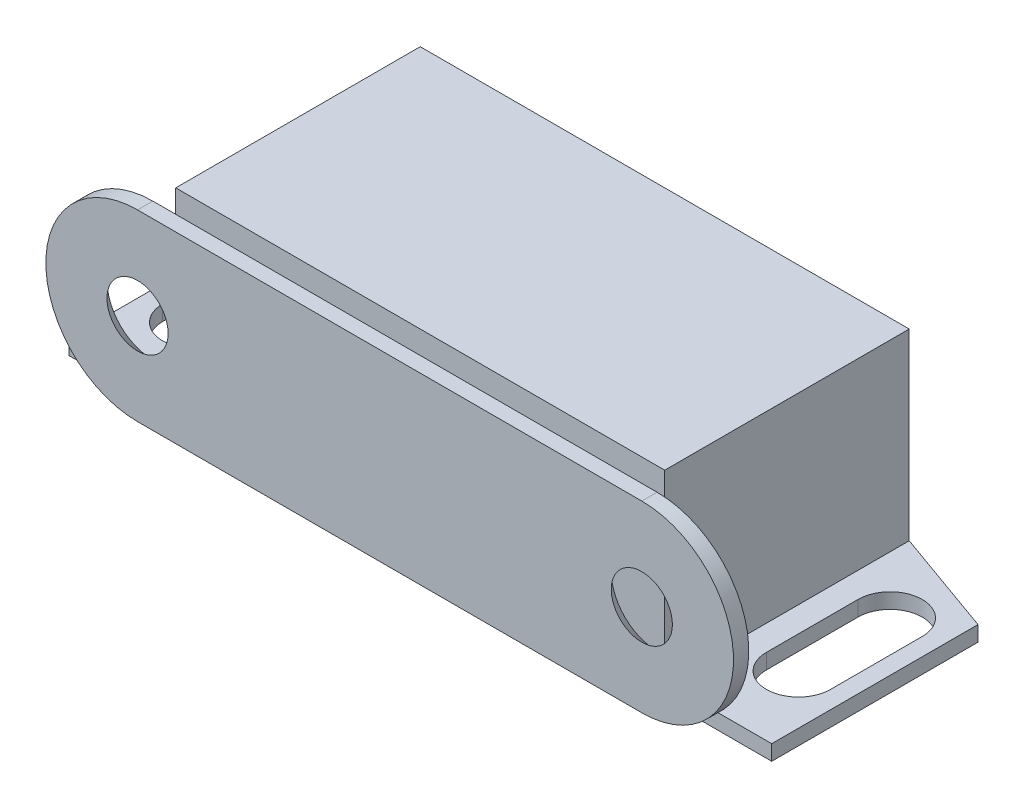
from build123d import *

# Parameters (mm, degrees)
SKETCH_1_W          = 15
SKETCH_1_H          = 12
EXTRUDE_1_DEPTH     = 16
CUT_EXTRUDE_1_DEPTH = 16
CUT_EXTRUDE_2_DEPTH = 16
SKETCH_4_W          = 22
SKETCH_4_H          = 1
EXTRUDE_2_DEPTH     = 1
SKETCH_5_R          = 2
EXTRUDE_3_DEPTH     = 1
CHAMFER_1_SIZE      = 1


with BuildPart() as part:
    # 草图1 → 凸台-拉伸1 (new body)
    with BuildSketch(Plane.XY):
        with Locations((15.5, 6)):
            Rectangle(SKETCH_1_W, SKETCH_1_H)
        with Locations((30.5, 6)):
            Rectangle(SKETCH_1_W, SKETCH_1_H)
        Polygon((0, 1), (0, 0), (8, 0), (8, 12), (23, 12), (23, 13), (7, 13), (7, 1), align=None)
        Polygon((23, 13), (23, 12), (38, 12), (38, 0), (46, 0), (46, 1), (39, 1), (39, 13), align=None)
    extrude(amount=-EXTRUDE_1_DEPTH)

    # 草图2 → 切除-拉伸1 (cut)
    with BuildSketch(Plane(origin=(0, 1, 0), x_dir=(1, 0, 0), z_dir=(0, 1, 0))):
        with BuildLine():
            Line((40.65, 5), (40.65, 11))
            ThreePointArc((40.65, 11), (42.75, 13.1), (44.85, 11))
            Line((44.85, 11), (44.85, 5))
            ThreePointArc((44.85, 5), (42.75, 2.9), (40.65, 5))
        make_face()
        with BuildLine():
            Line((5.35, 5), (5.35, 11))
            ThreePointArc((5.35, 11), (3.25, 13.1), (1.15, 11))
            Line((1.15, 11), (1.15, 5))
            ThreePointArc((1.15, 5), (3.25, 2.9), (5.35, 5))
        make_face()
    extrude(amount=-CUT_EXTRUDE_1_DEPTH, mode=Mode.SUBTRACT)

    # 草图3 → 切除-拉伸2 (cut)
    with BuildSketch(Plane(origin=(0, 1, 0), x_dir=(1, 0, 0), z_dir=(0, 1, 0))):
        Polygon((39, 16), (46, 13.5), (46, 16), align=None)
        Polygon((0, 16), (7, 16), (0, 13.5), align=None)
    extrude(amount=-CUT_EXTRUDE_2_DEPTH, mode=Mode.SUBTRACT)

    # 草图4 → 凸台-拉伸2 (add)
    with BuildSketch(Plane.XY):
        with Locations((23, 9.5)):
            Rectangle(SKETCH_4_W, SKETCH_4_H)
        with Locations((23, 4.5)):
            Rectangle(SKETCH_4_W, SKETCH_4_H)
    extrude(amount=EXTRUDE_2_DEPTH)


with BuildPart() as body_2:
    # 草图5 → 凸台-拉伸3 (new body)
    with BuildSketch(Plane.XY.offset(1)):
        with BuildLine():
            Line((6.5, 12.5), (39.5, 12.5))
            ThreePointArc((39.5, 12.5), (45.5, 6.5), (39.5, 0.5))
            Line((39.5, 0.5), (6.5, 0.5))
            ThreePointArc((6.5, 0.5), (0.5, 6.5), (6.5, 12.5))
        make_face()
        with Locations((6.5, 6.5)):
            Circle(SKETCH_5_R, mode=Mode.SUBTRACT)
        with Locations((39.5, 6.5)):
            Circle(SKETCH_5_R, mode=Mode.SUBTRACT)
    extrude(amount=EXTRUDE_3_DEPTH)

    # 倒角1
    chamfer_1_edges = [body_2.edges().sort_by_distance(p)[0] for p in [
        (4.5, 6.5, 1),
        (37.5, 6.5, 1),
    ]]
    chamfer(chamfer_1_edges, length=CHAMFER_1_SIZE - 0.0001)  # a hair under: the kernel refuses the full size


solid = Compound([part.part, body_2.part])
